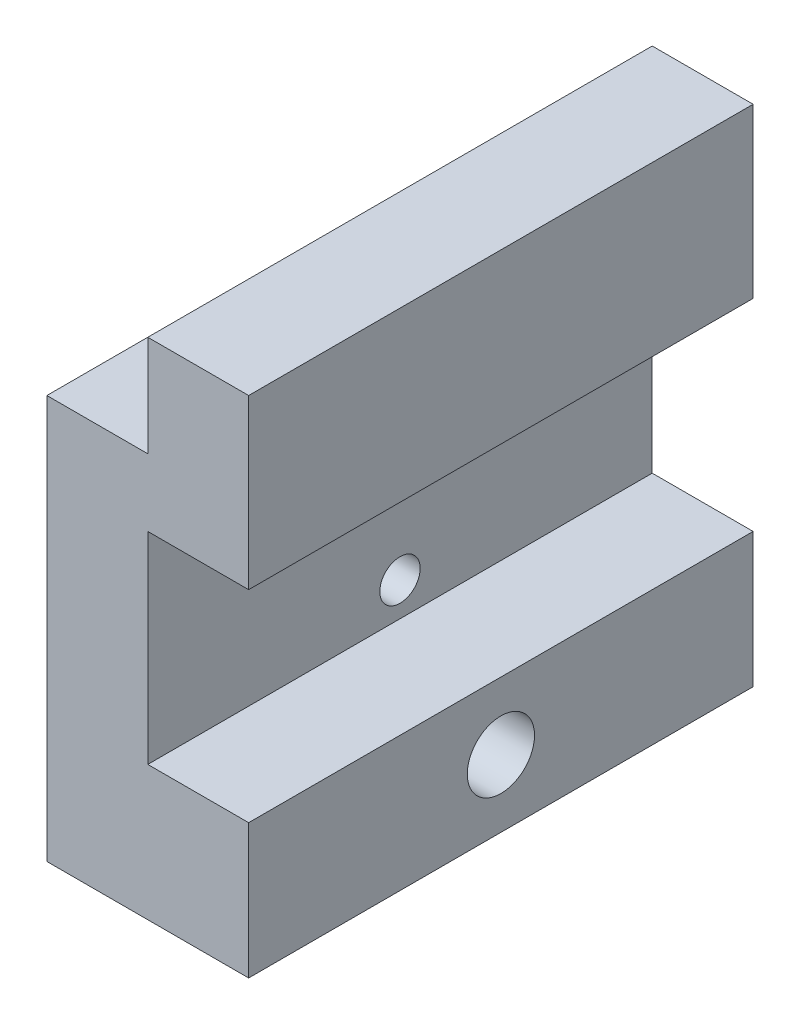
from build123d import *

# Parameters (mm, degrees)
BOSS_EXTRUDE1_DEPTH = 75
SKETCH2_R           = 5
CUT_EXTRUDE1_DEPTH  = 50
SKETCH3_R           = 3
CUT_EXTRUDE2_DEPTH  = 101


with BuildPart() as part:
    # Sketch1 → Boss-Extrude1 (new body)
    with BuildSketch(Plane.XY):
        Polygon((30, 0), (0, 0), (0, 60), (15, 60), (15, 75), (30, 75), (30, 60), (30, 50), (15, 50), (15, 20), (30, 20), align=None)
    extrude(amount=-BOSS_EXTRUDE1_DEPTH)

    # Sketch2 → Cut-Extrude1 (cut)
    with BuildSketch(Plane(origin=(30, 0, 0), x_dir=(0, 0, -1), z_dir=(1, 0, 0))):
        with Locations((37.5, 10)):
            Circle(SKETCH2_R)
    extrude(amount=-CUT_EXTRUDE1_DEPTH, mode=Mode.SUBTRACT)

    # Sketch3 → Cut-Extrude2 (cut)
    with BuildSketch(Plane.ZY):
        with Locations((-37.5, 25)):
            Circle(SKETCH3_R)
    extrude(amount=-CUT_EXTRUDE2_DEPTH, mode=Mode.SUBTRACT)


solid = part.part
